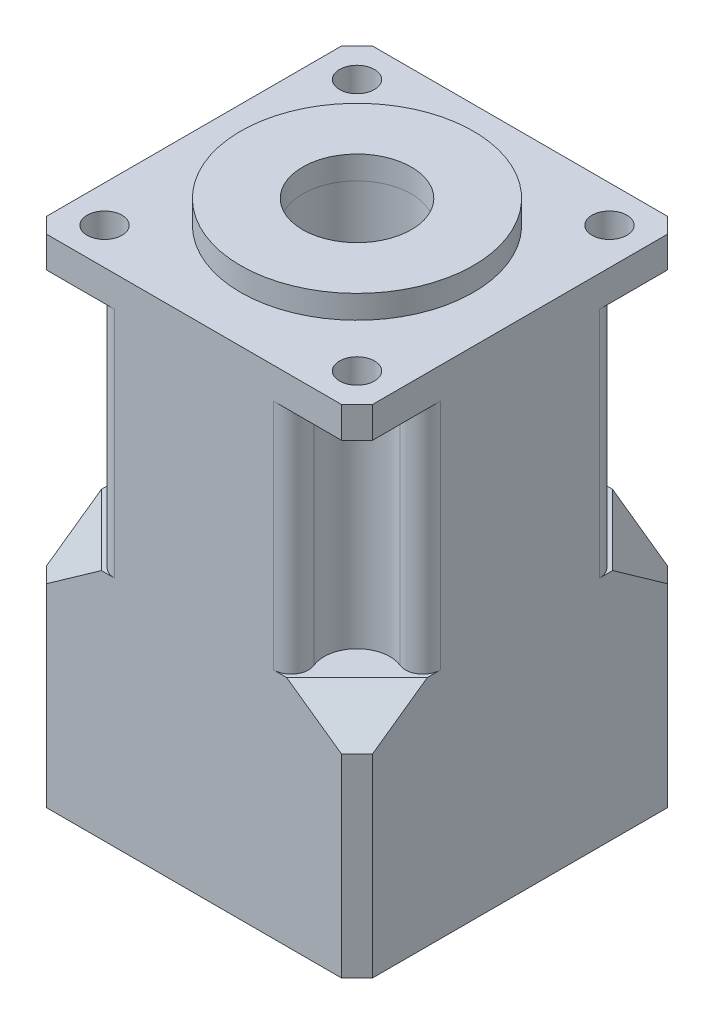
from build123d import *

# Parameters (mm, degrees)
SKETCH1_R           = 7
BOSS_EXTRUDE1_DEPTH = 26
SKETCH1_3_R         = 15
SKETCH1_3_R_2       = 7
BOSS_EXTRUDE2_DEPTH = 3
SKETCH1_4_R         = 15
SKETCH1_4_R_2       = 2.25
SKETCH1_4_R_3       = 7
BOSS_EXTRUDE3_DEPTH = 4
BOSS_EXTRUDE4_DEPTH = 30
BOSS_EXTRUDE6_START = -64
SKETCH1_6_R         = 15
SKETCH1_6_R_2       = 2.25
SKETCH1_6_R_3       = 7
BOSS_EXTRUDE6_DEPTH = 30
CUT_EXTRUDE3_START  = -64
SKETCH1_7_R         = 2.25
CUT_EXTRUDE3_DEPTH  = 5
CUT_EXTRUDE4_START  = -64
SKETCH1_8_R         = 15
SKETCH1_8_R_2       = 7
CUT_EXTRUDE4_DEPTH  = 5
CHAMFER1_START      = 4.04163056
CHAMFER1_DEPTH      = 3.535533906
CHAMFER2_START      = -7.577164466
CHAMFER2_DEPTH      = 3.535533906
CHAMFER3_START      = 4.04163056
CHAMFER3_DEPTH      = 3.535533906
CHAMFER4_START      = -7.577164466
CHAMFER4_DEPTH      = 3.535533906
CUT_EXTRUDE5_START  = -85
SKETCH4_R           = 7
CUT_EXTRUDE5_DEPTH  = 85


with BuildPart() as part:
    # Sketch1 → Boss-Extrude1 (new body)
    with BuildSketch(Plane(origin=(0, 0, 0), x_dir=(1, 0, 0), z_dir=(0, 1, 0))):
        with Locations(Location((0, 0, 0), (0, 0, 90))):
            Circle(SKETCH1_R)
    extrude(amount=BOSS_EXTRUDE1_DEPTH)

    # Sketch1<3> → Boss-Extrude2 (add)
    with BuildSketch(Plane(origin=(0, 0, 0), x_dir=(1, 0, 0), z_dir=(0, 1, 0))):
        with Locations(Location((0, 0, 0), (0, 0, 270))):
            Circle(SKETCH1_3_R)
        with Locations(Location((0, 0, 0), (0, 0, 90))):
            Circle(SKETCH1_3_R_2, mode=Mode.SUBTRACT)
    extrude(amount=BOSS_EXTRUDE2_DEPTH)


with BuildPart() as body_2:
    # Sketch1<4> → Boss-Extrude3 (new body)
    # profile 1 of 3: a face of its own
    with BuildSketch(Plane(origin=(0, 0, 0), x_dir=(1, 0, 0), z_dir=(0, 1, 0))):
        Polygon((-19, -21), (19, -21), (21, -19), (21, 19), (19, 21), (-19, 21), (-21, 19), (-21, -19), align=None)
        with Locations(Location((0, 0, 0), (0, 0, 270))):
            Circle(SKETCH1_4_R, mode=Mode.SUBTRACT)
        with Locations(Location((16.263455967, -16.263455967, 0), (0, 0, 270))):
            Circle(SKETCH1_4_R_2, mode=Mode.SUBTRACT)
        with Locations(Location((16.263455967, 16.263455967, 0), (0, 0, 270))):
            Circle(SKETCH1_4_R_2, mode=Mode.SUBTRACT)
        with Locations(Location((-16.263455967, 16.263455967, 0), (0, 0, 270))):
            Circle(SKETCH1_4_R_2, mode=Mode.SUBTRACT)
        with Locations(Location((-16.263455967, -16.263455967, 0), (0, 0, 270))):
            Circle(SKETCH1_4_R_2, mode=Mode.SUBTRACT)
    # profile 2 of 3: a face of its own
    with BuildSketch(Plane(origin=(0, 0, 0), x_dir=(1, 0, 0), z_dir=(0, 1, 0))):
        with Locations(Location((0, 0, 0), (0, 0, 270))):
            Circle(SKETCH1_4_R)
        with Locations(Location((0, 0, 0), (0, 0, 90))):
            Circle(SKETCH1_4_R_3, mode=Mode.SUBTRACT)
    # profile 3 of 3: a face of its own
    with BuildSketch(Plane(origin=(0, 0, 0), x_dir=(1, 0, 0), z_dir=(0, 1, 0))):
        with Locations(Location((0, 0, 0), (0, 0, 90))):
            Circle(SKETCH1_4_R_3)
    extrude(amount=-BOSS_EXTRUDE3_DEPTH)

    # Sketch3 → Boss-Extrude4 (add)
    with BuildSketch(Plane.XZ.offset(4)):
        with BuildLine():
            Line((-10.257867006, 21), (10.257867006, 21))
            ThreePointArc((10.257867006, 21), (12.128580139, 20.000172937), (12.336724723, 17.889273219))
            ThreePointArc((12.336724723, 17.889273219), (13.258252147, 13.258252147), (17.889273219, 12.336724723))
            ThreePointArc((17.889273219, 12.336724723), (20.000172937, 12.128580139), (21, 10.257867006))
            Line((21, 10.257867006), (21, -10.257867006))
            ThreePointArc((21, -10.257867006), (20.000172937, -12.128580139), (17.889273219, -12.336724723))
            ThreePointArc((17.889273219, -12.336724723), (13.258252147, -13.258252147), (12.336724723, -17.889273219))
            ThreePointArc((12.336724723, -17.889273219), (12.128580139, -20.000172937), (10.257867006, -21))
            Line((10.257867006, -21), (-10.257867006, -21))
            ThreePointArc((-10.257867006, -21), (-12.128580139, -20.000172937), (-12.336724723, -17.889273219))
            ThreePointArc((-12.336724723, -17.889273219), (-13.258252147, -13.258252147), (-17.889273219, -12.336724723))
            ThreePointArc((-17.889273219, -12.336724723), (-20.000172937, -12.128580139), (-21, -10.257867006))
            Line((-21, -10.257867006), (-21, 10.257867006))
            ThreePointArc((-21, 10.257867006), (-20.000172937, 12.128580139), (-17.889273219, 12.336724723))
            ThreePointArc((-17.889273219, 12.336724723), (-13.258252147, 13.258252147), (-12.336724723, 17.889273219))
            ThreePointArc((-12.336724723, 17.889273219), (-12.128580139, 20.000172937), (-10.257867006, 21))
        make_face()
    extrude(amount=BOSS_EXTRUDE4_DEPTH)

    # Sketch1<6> → Boss-Extrude6 (add)
    # profile 1 of 6: a face of its own
    with BuildSketch(Plane(origin=(0, 0, 0), x_dir=(1, 0, 0), z_dir=(0, 1, 0)).offset(BOSS_EXTRUDE6_START)):
        Polygon((-19, -21), (19, -21), (21, -19), (21, 19), (19, 21), (-19, 21), (-21, 19), (-21, -19), align=None)
        with Locations(Location((0, 0, 0), (0, 0, 270))):
            Circle(SKETCH1_6_R, mode=Mode.SUBTRACT)
        with Locations(Location((16.263455967, -16.263455967, 0), (0, 0, 270))):
            Circle(SKETCH1_6_R_2, mode=Mode.SUBTRACT)
        with Locations(Location((16.263455967, 16.263455967, 0), (0, 0, 270))):
            Circle(SKETCH1_6_R_2, mode=Mode.SUBTRACT)
        with Locations(Location((-16.263455967, 16.263455967, 0), (0, 0, 270))):
            Circle(SKETCH1_6_R_2, mode=Mode.SUBTRACT)
        with Locations(Location((-16.263455967, -16.263455967, 0), (0, 0, 270))):
            Circle(SKETCH1_6_R_2, mode=Mode.SUBTRACT)
    # profile 2 of 6: a face of its own
    with BuildSketch(Plane(origin=(0, 0, 0), x_dir=(1, 0, 0), z_dir=(0, 1, 0)).offset(BOSS_EXTRUDE6_START)):
        with Locations(Location((-16.263455967, 16.263455967, 0), (0, 0, 270))):
            Circle(SKETCH1_6_R_2)
    # profile 3 of 6: a face of its own
    with BuildSketch(Plane(origin=(0, 0, 0), x_dir=(1, 0, 0), z_dir=(0, 1, 0)).offset(BOSS_EXTRUDE6_START)):
        with Locations(Location((16.263455967, 16.263455967, 0), (0, 0, 270))):
            Circle(SKETCH1_6_R_2)
    # profile 4 of 6: a face of its own
    with BuildSketch(Plane(origin=(0, 0, 0), x_dir=(1, 0, 0), z_dir=(0, 1, 0)).offset(BOSS_EXTRUDE6_START)):
        with Locations(Location((16.263455967, -16.263455967, 0), (0, 0, 270))):
            Circle(SKETCH1_6_R_2)
    # profile 5 of 6: a face of its own
    with BuildSketch(Plane(origin=(0, 0, 0), x_dir=(1, 0, 0), z_dir=(0, 1, 0)).offset(BOSS_EXTRUDE6_START)):
        with Locations(Location((-16.263455967, -16.263455967, 0), (0, 0, 270))):
            Circle(SKETCH1_6_R_2)
    # profile 6 of 6: a face of its own
    with BuildSketch(Plane(origin=(0, 0, 0), x_dir=(1, 0, 0), z_dir=(0, 1, 0)).offset(BOSS_EXTRUDE6_START)):
        with Locations(Location((0, 0, 0), (0, 0, 270))):
            Circle(SKETCH1_6_R)
        with Locations(Location((0, 0, 0), (0, 0, 90))):
            Circle(SKETCH1_6_R_3, mode=Mode.SUBTRACT)
    extrude(amount=BOSS_EXTRUDE6_DEPTH)

    # Sketch1<7> → Cut-Extrude3 (cut)
    with BuildSketch(Plane(origin=(0, 0, 0), x_dir=(1, 0, 0), z_dir=(0, 1, 0)).offset(CUT_EXTRUDE3_START)):
        with Locations(Location((-16.263455967, -16.263455967, 0), (0, 0, 270))):
            Circle(SKETCH1_7_R)
        with Locations(Location((-16.263455967, 16.263455967, 0), (0, 0, 270))):
            Circle(SKETCH1_7_R)
        with Locations(Location((16.263455967, 16.263455967, 0), (0, 0, 270))):
            Circle(SKETCH1_7_R)
        with Locations(Location((16.263455967, -16.263455967, 0), (0, 0, 270))):
            Circle(SKETCH1_7_R)
    extrude(amount=CUT_EXTRUDE3_DEPTH, mode=Mode.SUBTRACT)

    # Sketch1<8> → Cut-Extrude4 (cut)
    with BuildSketch(Plane(origin=(0, 0, 0), x_dir=(1, 0, 0), z_dir=(0, 1, 0)).offset(CUT_EXTRUDE4_START)):
        with Locations(Location((0, 0, 0), (0, 0, 270))):
            Circle(SKETCH1_8_R)
        with Locations(Location((0, 0, 0), (0, 0, 270))):
            Circle(SKETCH1_8_R_2, mode=Mode.SUBTRACT)
    extrude(amount=CUT_EXTRUDE4_DEPTH, mode=Mode.SUBTRACT)

    # Chamfer1: read off the stored shape, not the designer's step
    # Chamfer1 outline → Chamfer1 (cut)
    with BuildSketch(Plane(origin=(0, 0, 0), x_dir=(0.8660254037844387, 0.408248290463863, -0.28867513459481264), z_dir=(0.49999999999999983, -0.7071067811865479, 0.49999999999999983)).offset(CHAMFER1_START)):
        Polygon((-18.149022364, -36.776337352), (-28.62338925, -29.369841498), (-28.62338925, -38.030095536), (-26.313988174, -39.663088698), align=None)
    extrude(amount=CHAMFER1_DEPTH, mode=Mode.SUBTRACT)

    # Chamfer2: read off the stored shape, not the designer's step
    # Chamfer2 outline → Chamfer2 (cut)
    with BuildSketch(Plane(origin=(0, 0, 0), x_dir=(0.8660254037844386, -0.40824829046386313, 0.2886751345948132), z_dir=(0.5000000000000002, 0.7071067811865472, -0.5000000000000002)).offset(CHAMFER2_START)):
        Polygon((26.313988174, 39.663088698), (18.149022364, 36.776337352), (28.62338925, 29.369841498), (28.62338925, 38.030095536), align=None)
    extrude(amount=CHAMFER2_DEPTH, mode=Mode.SUBTRACT)

    # Chamfer3: read off the stored shape, not the designer's step
    # Chamfer3 outline → Chamfer3 (cut)
    with BuildSketch(Plane(origin=(0, 0, 0), x_dir=(0.8660254037844386, 0.40824829046386313, 0.2886751345948132), z_dir=(0.5000000000000002, -0.7071067811865472, -0.5000000000000002)).offset(CHAMFER3_START)):
        Polygon((-28.62338925, 29.369841498), (-18.149022364, 36.776337352), (-26.313988174, 39.663088698), (-28.62338925, 38.030095536), align=None)
    extrude(amount=CHAMFER3_DEPTH, mode=Mode.SUBTRACT)

    # Chamfer4: read off the stored shape, not the designer's step
    # Chamfer4 outline → Chamfer4 (cut)
    with BuildSketch(Plane(origin=(0, 0, 0), x_dir=(0.8660254037844387, -0.408248290463863, -0.28867513459481264), z_dir=(0.49999999999999983, 0.7071067811865479, 0.49999999999999983)).offset(CHAMFER4_START)):
        Polygon((28.62338925, -38.030095536), (28.62338925, -29.369841498), (18.149022364, -36.776337352), (26.313988174, -39.663088698), align=None)
    extrude(amount=CHAMFER4_DEPTH, mode=Mode.SUBTRACT)


with BuildPart() as cut_extrude5_tool:
    # Sketch4 → Cut-Extrude5 (new body)
    with BuildSketch(Plane(origin=(0, 26, 0), x_dir=(1, 0, 0), z_dir=(0, 1, 0)).offset(CUT_EXTRUDE5_START)):
        with Locations(Location((0, 0, 0), (0, 0, 270))):
            Circle(SKETCH4_R)
    extrude(amount=CUT_EXTRUDE5_DEPTH)


with BuildPart() as part_1:
    add(part.part)

    # Cut-Extrude5: cut by cut_extrude5_tool
    add(cut_extrude5_tool.part, mode=Mode.SUBTRACT)


with BuildPart() as body_2_1:
    add(body_2.part)

    # Cut-Extrude5: cut by cut_extrude5_tool
    add(cut_extrude5_tool.part, mode=Mode.SUBTRACT)


solid = Compound([part_1.part, body_2_1.part])
